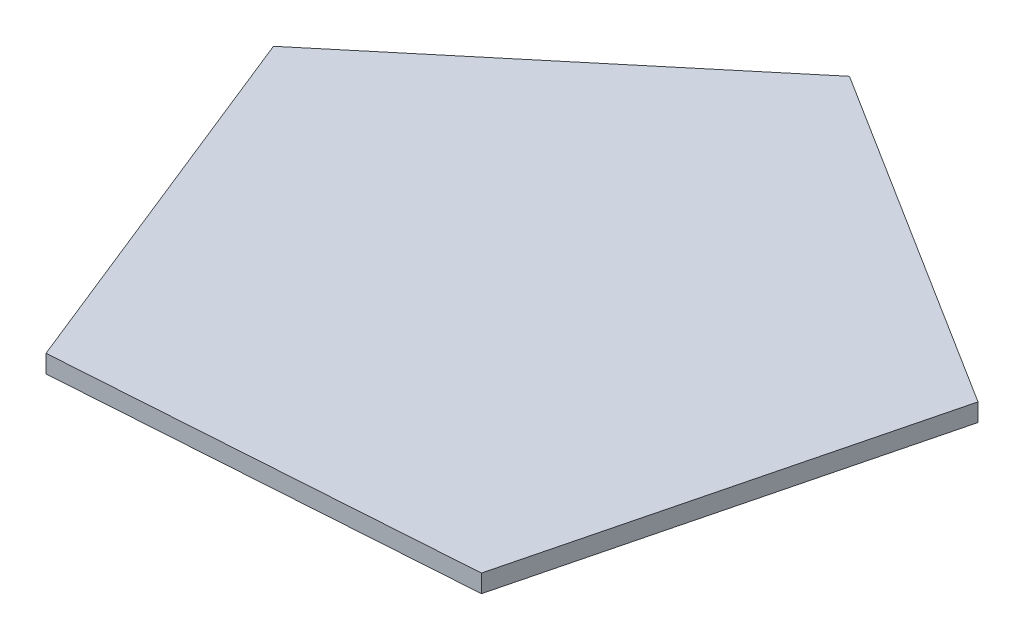
from build123d import *

# Parameters (mm, degrees)
BOSS_EXTRUDE1_DEPTH = 3.18


with BuildPart() as part:
    # Sketch1 → Boss-Extrude1 (new body)
    with BuildSketch(Plane(origin=(0, 0, 0), x_dir=(1, 0, 0), z_dir=(0, 1, 0))):
        Polygon((-59.925822748, 15.118064705), (-32.896231583, -52.321105303), (39.594833528, -47.454286112), (57.367184482, 22.992743574), (-4.139963679, 61.664583135), align=None)
    extrude(amount=BOSS_EXTRUDE1_DEPTH)


solid = part.part
